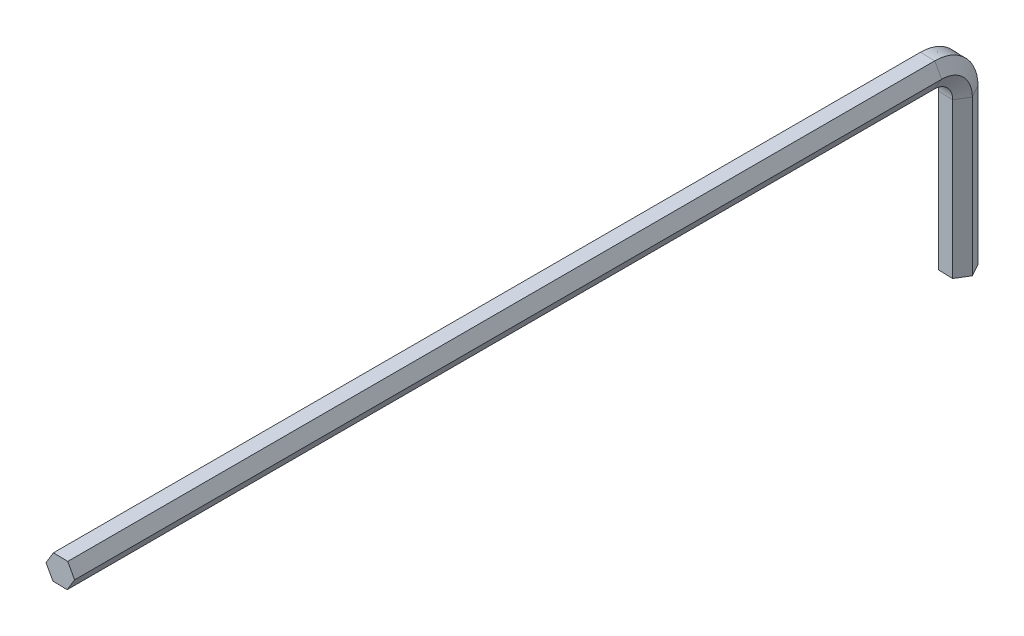
from build123d import *


with BuildPart() as part:
    # Sweep1: sweep along a curve in space
    with BuildLine() as sweep1_path:
        Line((0, 0, 0), (0, 25, 0))
        ThreePointArc((0, 30, 5), (0, 28.535533906, 1.464466094), (0, 25, 0))
        Line((0, 30, 5), (0, 30, 145))
    # Sketch1 → Sweep1 (sweep)
    with BuildSketch(Plane(origin=(0, 0, 0), x_dir=(-1, 0, 0), z_dir=(0, 1, 0))):
        Polygon((2.308874637, -0.049307649), (1.197138995, 1.974890265), (-1.111735642, 2.024197914), (-2.308874637, 0.049307649), (-1.197138995, -1.974890265), (1.111735642, -2.024197914), align=None)
    sweep(path=sweep1_path.line)


solid = part.part
